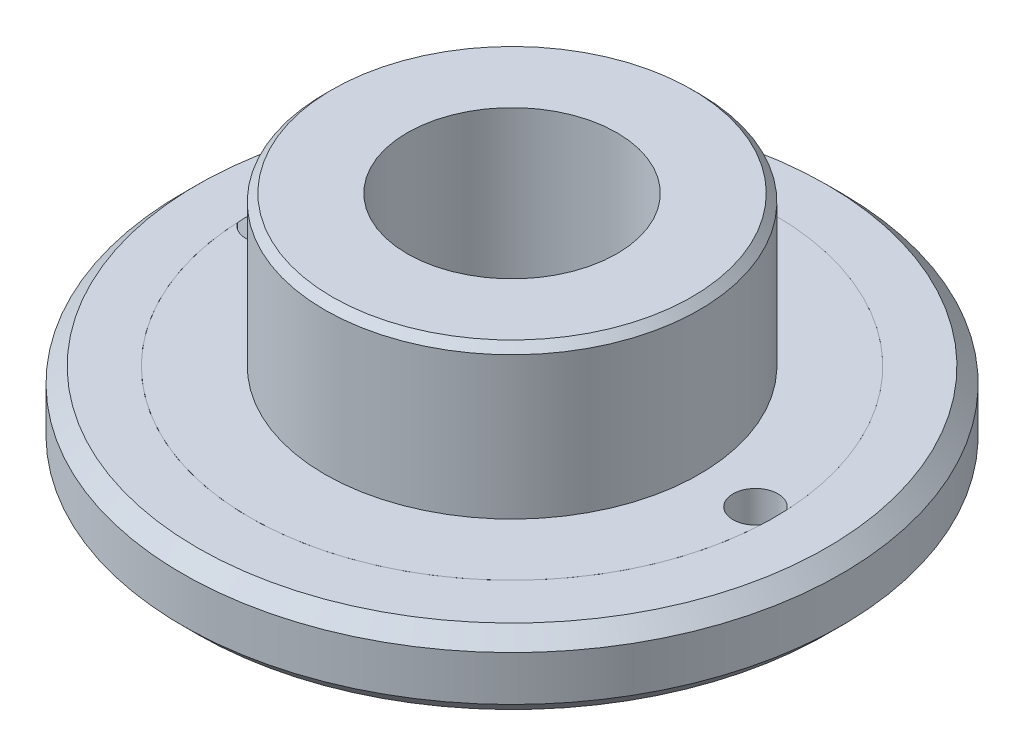
from build123d import *

# Parameters (mm, degrees)
SKETCH_4_R          = 1.5
CUT_EXTRUDE_2_DEPTH = 33.680403915
CHAMFER_1_SIZE      = 0.5


with BuildPart() as part:
    # Эскиз1 → Revolve 1 (revolve)
    with BuildSketch(Plane.XY):
        Polygon((12.5, 15), (7, 15), (7, 0), (17.5, 0), (17.5, 5), (12.5, 5), align=None)
    revolve(axis=Axis((0, 0, 0), (0, 1, 0)))

    # Эскиз3 → Revolve 1 2 (revolve)
    with BuildSketch(Plane.XY):
        Polygon((17.4999, -0.0001), (17.4999, 5.0001), (21.000041421, 5.0001), (22.0001, 4.000041421), (22.0001, 0.999958579), (21.000041421, -0.0001), align=None)
        Polygon((17.5, 0), (17.5, 5), (21, 5), (22, 4), (22, 1), (21, 0), align=None, mode=Mode.SUBTRACT)
    revolve(axis=Axis((0, 0, 0), (0, 1, 0)))

    # Эскиз4 → Вырез-Вытянуть2 (cut, through all)
    with BuildSketch(Plane(origin=(0, 5, 0), x_dir=(1, 0, 0), z_dir=(0, 1, 0))):
        with Locations((-16.25, 0)):
            Circle(SKETCH_4_R)
        with Locations((16.25, 0)):
            Circle(SKETCH_4_R)
    extrude(amount=-CUT_EXTRUDE_2_DEPTH, mode=Mode.SUBTRACT)

    # Фаска1
    chamfer_1_edges = [part.edges().sort_by_distance(p)[0] for p in [
        (-12.5, 15, 0),
    ]]
    chamfer(chamfer_1_edges, length=CHAMFER_1_SIZE)


solid = part.part
